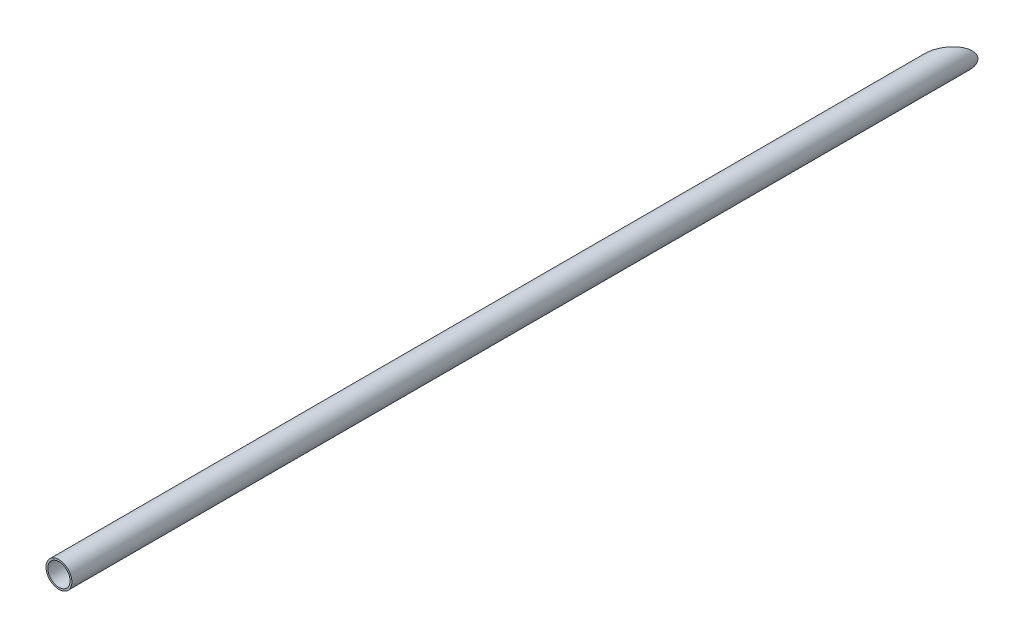
from build123d import *

# Parameters (mm, degrees)
SKETCH1_R               = 12.7
SKETCH1_R_2             = 10.922
BOSS_EXTRUDE1_DEPTH     = 889
CUT_EXTRUDE1_DEPTH      = 890.181410062
CUT_EXTRUDE1_DEPTH_BACK = 890.181410062


with BuildPart() as part:
    # Sketch1 → Boss-Extrude1 (new body)
    with BuildSketch(Plane.XY):
        Circle(SKETCH1_R)
        Circle(SKETCH1_R_2, mode=Mode.SUBTRACT)
    extrude(amount=BOSS_EXTRUDE1_DEPTH)

    # Sketch3 → Cut-Extrude1 (cut, two sides: drawn at the far end of the back side and taken through both)
    with BuildSketch(Plane(origin=(0, 0, 0), x_dir=(1, 0, 0), z_dir=(0, 1, 0)).offset(-CUT_EXTRUDE1_DEPTH_BACK)):
        Polygon((0, 0), (12.7, 0), (-50.8, -90.687398428), (-50.8, 0), align=None)
    extrude(amount=CUT_EXTRUDE1_DEPTH + CUT_EXTRUDE1_DEPTH_BACK, mode=Mode.SUBTRACT)


solid = part.part
